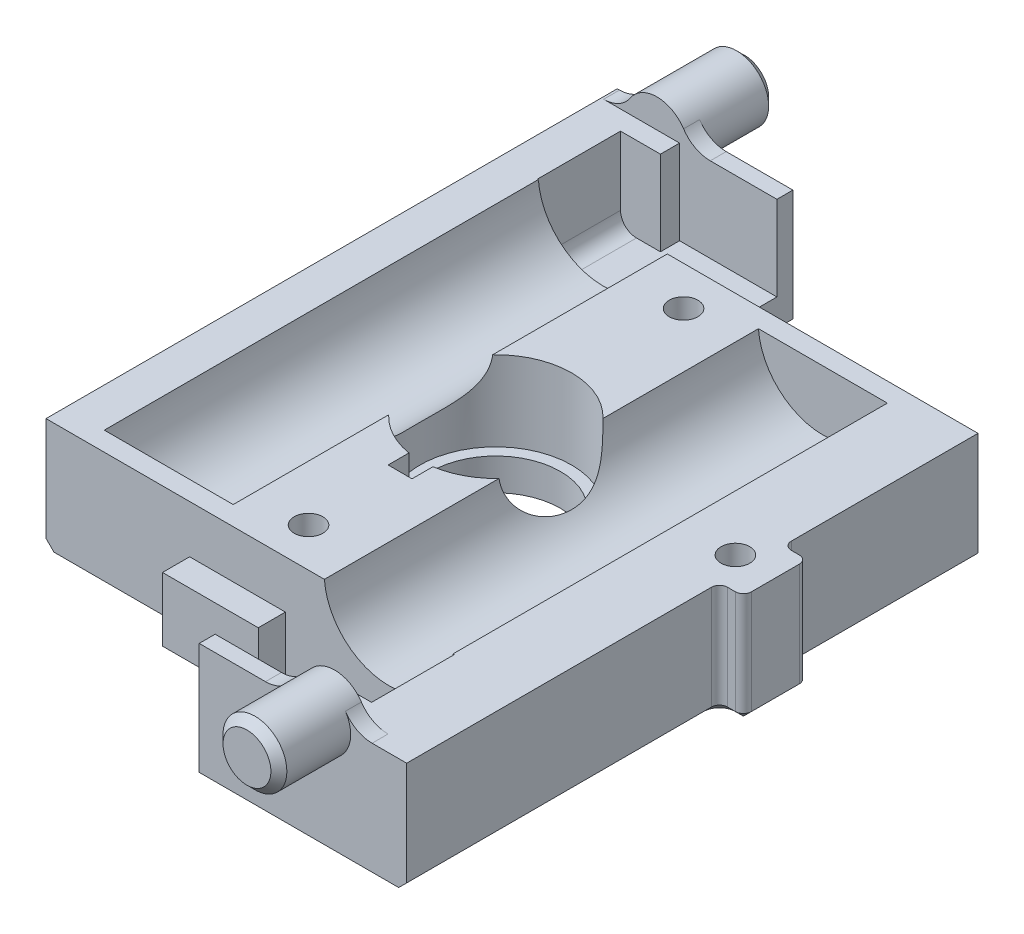
from build123d import *

# Parameters (mm, degrees)
SKETCH1_W            = 30
SKETCH1_H            = 30.8
BOSS_EXTRUDE1_DEPTH  = 7
SKETCH2_R            = 4.05
CUT_EXTRUDE1_DEPTH   = 6.5
SKETCH3_W            = 15
SKETCH3_H            = 1.2
SKETCH3_W_2          = 9
SKETCH3_W_3          = 11
SKETCH3_W_4          = 13
CUT_EXTRUDE2_DEPTH   = 4
SKETCH4_W            = 30
SKETCH4_H            = 3
CUT_EXTRUDE3_DEPTH   = 1.2
SKETCH5_W            = 30
SKETCH5_H            = 3
CUT_EXTRUDE4_DEPTH   = 1.2
SKETCH6_R            = 4.05
CUT_EXTRUDE5_DEPTH   = 27.2
SKETCH7_R            = 4.05
CUT_EXTRUDE6_DEPTH   = 27.2
SKETCH8_R            = 4.75
CUT_EXTRUDE7_DEPTH   = 5
BOSS_EXTRUDE2_DEPTH  = 6.4
FILLET1_R            = 1
BOSS_EXTRUDE3_DEPTH  = 6.4
FILLET2_R            = 1
SKETCH12_W           = 1.5
SKETCH12_H           = 1.344099237
CUT_EXTRUDE8_DEPTH   = 5
SKETCH13_W           = 13
SKETCH13_H           = 7
BOSS_EXTRUDE4_DEPTH  = 1
SKETCH14_W           = 11
SKETCH14_H           = 7
BOSS_EXTRUDE5_DEPTH  = 1
SKETCH15_R           = 2
BOSS_EXTRUDE8_DEPTH  = 5.5
SKETCH16_R           = 2
BOSS_EXTRUDE9_DEPTH  = 5.5
FILLET3_R            = 2
FILLET4_R            = 2
FILLET5_R            = 2
CHAMFER2_SIZE        = 0.5
CHAMFER3_SIZE        = 0.5
SKETCH17_W           = 4
SKETCH17_H           = 7
BOSS_EXTRUDE10_DEPTH = 1.5
FILLET7_R            = 0.5
SKETCH18_R           = 0.9
CUT_EXTRUDE9_DEPTH   = 99.965895754
SKETCH19_R           = 1.6
CUT_EXTRUDE10_DEPTH  = 2
SKETCH20_R           = 0.9
CUT_EXTRUDE11_DEPTH  = 99.965895754
SKETCH21_R           = 1.6
CUT_EXTRUDE12_DEPTH  = 2
CHAMFER6_SIZE        = 0.5
SKETCH22_W           = 6
SKETCH22_H           = 4
BOSS_EXTRUDE11_DEPTH = 0.5
SKETCH23_W           = 6
SKETCH23_H           = 4
BOSS_EXTRUDE12_DEPTH = 0.5
BOSS_EXTRUDE13_REACH = 100.822
SKETCH24_W           = 4.732966807
SKETCH24_H           = 1.2
SKETCH24_W_2         = 4.75835454


# Some blends are built 0.0001 mm under size
with BuildPart() as part:
    # Sketch1 → Boss-Extrude1 (new body)
    with BuildSketch(Plane(origin=(0, 0, 0), x_dir=(1, 0, 0), z_dir=(0, 1, 0))):
        with Locations((-46.45686042, -50.970505576)):
            Rectangle(SKETCH1_W, SKETCH1_H)
    extrude(amount=BOSS_EXTRUDE1_DEPTH)

    # Sketch2 → Cut-Extrude1 (cut)
    with BuildSketch(Plane.XZ):
        with Locations(Location((-47.47186042, 50.970505576, 0), (0, 0, 270))):
            Circle(SKETCH2_R)
    extrude(amount=-CUT_EXTRUDE1_DEPTH, mode=Mode.SUBTRACT)

    # Sketch3 → Cut-Extrude2 (cut)
    with BuildSketch(Plane.XZ):
        with Locations((-38.95686042, 65.770505576)):
            Rectangle(SKETCH3_W, SKETCH3_H)
        with Locations((-56.95686042, 65.770505576)):
            Rectangle(SKETCH3_W_2, SKETCH3_H)
        with Locations((-36.95686042, 36.170505576)):
            Rectangle(SKETCH3_W_3, SKETCH3_H)
        with Locations((-54.95686042, 36.170505576)):
            Rectangle(SKETCH3_W_4, SKETCH3_H)
    extrude(amount=-CUT_EXTRUDE2_DEPTH, mode=Mode.SUBTRACT)

    # Sketch4 → Cut-Extrude3 (cut)
    with BuildSketch(Plane.XY.offset(66.370505576)):
        with Locations((-46.45686042, 5.5)):
            Rectangle(SKETCH4_W, SKETCH4_H)
    extrude(amount=-CUT_EXTRUDE3_DEPTH, mode=Mode.SUBTRACT)

    # Sketch5 → Cut-Extrude4 (cut)
    with BuildSketch(Plane(origin=(0, 0, 35.570505576), x_dir=(-1, 0, 0), z_dir=(0, 0, -1))):
        with Locations((46.45686042, 5.5)):
            Rectangle(SKETCH5_W, SKETCH5_H)
    extrude(amount=-CUT_EXTRUDE4_DEPTH, mode=Mode.SUBTRACT)

    # Sketch6 → Cut-Extrude5 (cut)
    with BuildSketch(Plane.XY.offset(65.170505576)):
        with Locations((-39.974556342, 7.3)):
            Circle(SKETCH6_R)
    extrude(amount=-CUT_EXTRUDE5_DEPTH, mode=Mode.SUBTRACT)

    # Sketch7 → Cut-Extrude6 (cut)
    with BuildSketch(Plane(origin=(0, 0, 36.770505576), x_dir=(-1, 0, 0), z_dir=(0, 0, -1))):
        with Locations((54.96455223, 7.3)):
            Circle(SKETCH7_R)
    extrude(amount=-CUT_EXTRUDE6_DEPTH, mode=Mode.SUBTRACT)

    # Sketch8 → Cut-Extrude7 (cut)
    with BuildSketch(Plane(origin=(0, 7, 0), x_dir=(1, 0, 0), z_dir=(0, 1, 0))):
        with Locations(Location((-47.47186042, -50.970505576, 0), (0, 0, 270))):
            Circle(SKETCH8_R)
    extrude(amount=-CUT_EXTRUDE7_DEPTH, mode=Mode.SUBTRACT)

    # Sketch10 → Boss-Extrude2 (add)
    with BuildSketch(Plane.XY.offset(65.170505576)):
        Polygon((-31.45686042, 0), (-31.45686042, 7), (-35.85686042, 7), (-35.85686042, 1.7), (-44.45686042, 1.7), (-44.45686042, 0), align=None)
    extrude(amount=BOSS_EXTRUDE2_DEPTH)

    # Fillet1
    fillet1_edges = [part.edges().sort_by_distance(p)[0] for p in [
        (-35.85686042, 1.7, 68.370505576),
    ]]
    fillet(fillet1_edges, radius=FILLET1_R)

    # Sketch11 → Boss-Extrude3 (add)
    with BuildSketch(Plane(origin=(0, 0, 36.770505576), x_dir=(-1, 0, 0), z_dir=(0, 0, -1))):
        Polygon((61.45686042, 7), (61.45686042, 0), (50.45686042, 0), (50.45686042, 1.7), (59.05686042, 1.7), (59.05686042, 7), align=None)
    extrude(amount=BOSS_EXTRUDE3_DEPTH)

    # Fillet2
    fillet2_edges = [part.edges().sort_by_distance(p)[0] for p in [
        (-59.05686042, 1.7, 33.570505576),
    ]]
    fillet(fillet2_edges, radius=FILLET2_R)

    # Sketch12 → Cut-Extrude8 (cut)
    with BuildSketch(Plane(origin=(0, 7, 0), x_dir=(1, 0, 0), z_dir=(0, 1, 0))):
        with Locations((-47.47186042, -56.298455958)):
            Rectangle(SKETCH12_W, SKETCH12_H)
    extrude(amount=-CUT_EXTRUDE8_DEPTH, mode=Mode.SUBTRACT)

    # Sketch13 → Boss-Extrude4 (add)
    with BuildSketch(Plane.XY.offset(71.570505576)):
        with Locations((-37.95686042, 3.5)):
            Rectangle(SKETCH13_W, SKETCH13_H)
    extrude(amount=BOSS_EXTRUDE4_DEPTH)

    # Sketch14 → Boss-Extrude5 (add)
    with BuildSketch(Plane(origin=(0, 0, 30.370505576), x_dir=(-1, 0, 0), z_dir=(0, 0, -1))):
        with Locations((55.95686042, 3.5)):
            Rectangle(SKETCH14_W, SKETCH14_H)
    extrude(amount=BOSS_EXTRUDE5_DEPTH)

    # Sketch15 → Boss-Extrude8 (add)
    with BuildSketch(Plane.XY.offset(71.570505576)):
        with Locations(Location((-36.96455223, 6.8, 0), (0, 0, 174.260829523))):
            Circle(SKETCH15_R)
    extrude(amount=BOSS_EXTRUDE8_DEPTH)

    # Sketch16 → Boss-Extrude9 (add)
    with BuildSketch(Plane(origin=(0, 0, 30.370505576), x_dir=(-1, 0, 0), z_dir=(0, 0, -1))):
        with Locations(Location((57.974556342, 6.8, 0), (0, 0, 174.260829523))):
            Circle(SKETCH16_R)
    extrude(amount=BOSS_EXTRUDE9_DEPTH)

    # Fillet3
    fillet3_edges = [part.edges().sort_by_distance(p)[0] for p in [
        (-59.964531217, 7, 29.870505576),
    ]]
    fillet(fillet3_edges, radius=FILLET3_R)

    # Fillet4
    # the kernel refuses this fillet: 2 mm, written as the material it adds along each edge
    with BuildSketch(Plane(origin=(-55.984581468, 7, 30.370505576), x_dir=(1.0, 7.52728269616064e-12, 0), z_dir=(0, 0, -1))) as fillet4_piece_1:
        with BuildLine():
            CenterArc((1.350683743, -2), FILLET4_R, 90, 56.632987031)
            ThreePointArc((-0.319645565, -0.9), (-0.105311329, -0.469360383), (0, 0))
            Line((0, 0), (1.350683743, 0))
        make_face()
    extrude(amount=1)

    # Fillet5
    # the kernel refuses this fillet: 2 mm, written as the material it adds along each edge
    with BuildSketch(Plane(origin=(-38.954527104, 7, 71.570505576), x_dir=(-1.0, 7.116297137925098e-12, 0), z_dir=(0, 0, 1)), Plane(origin=(-34.974577356, 7, 72.570505576), x_dir=(1, 0, 0), z_dir=(0, 0, -1))) as fillet5_piece_1:
        with BuildLine():
            CenterArc((1.350683743, -2), FILLET5_R, 90, 56.632987031)
            ThreePointArc((-0.319645565, -0.9), (-0.105311329, -0.469360383), (0, 0))
            Line((0, 0), (1.350683743, 0))
        make_face()
    extrude(amount=1)

    # Chamfer2
    chamfer2_edges = [part.edges().sort_by_distance(p)[0] for p in [
        (-34.974577356, 6.6, 77.070505576),
    ]]
    chamfer(chamfer2_edges, length=CHAMFER2_SIZE)

    # Chamfer3
    chamfer3_edges = [part.edges().sort_by_distance(p)[0] for p in [
        (-59.964531217, 6.6, 24.870505576),
    ]]
    chamfer(chamfer3_edges, length=CHAMFER3_SIZE)

    # Sketch17 → Boss-Extrude10 (add)
    with BuildSketch(Plane(origin=(-31.45686042, 0, 0), x_dir=(0, 0, -1), z_dir=(1, 0, 0))):
        with Locations((-50.970505576, 3.5)):
            Rectangle(SKETCH17_W, SKETCH17_H)
    extrude(amount=BOSS_EXTRUDE10_DEPTH)

    # Fillet7
    fillet7_edges = [part.edges().sort_by_distance(p)[0] for p in [
        (-31.45686042, 3.5, 52.970505576),
        (-31.45686042, 3.5, 48.970505576),
        (-29.95686042, 3.5, 52.970505576),
        (-29.95686042, 3.5, 48.970505576),
    ]]
    fillet(fillet7_edges, radius=FILLET7_R)

    # Sketch18 → Cut-Extrude9 (cut, through all)
    with BuildSketch(Plane.XZ):
        with Locations(Location((-32.45686042, 50.970505576, 0), (0, 0, 270))):
            Circle(SKETCH18_R)
    extrude(amount=-CUT_EXTRUDE9_DEPTH, mode=Mode.SUBTRACT)

    # Sketch19 → Cut-Extrude10 (cut)
    with BuildSketch(Plane.XZ):
        with Locations(Location((-32.45686042, 50.970505576, 0), (0, 0, 270))):
            Circle(SKETCH19_R)
    extrude(amount=-CUT_EXTRUDE10_DEPTH, mode=Mode.SUBTRACT)

    # Sketch20 → Cut-Extrude11 (cut, through all)
    with BuildSketch(Plane.XZ):
        with Locations(Location((-47.45686042, 62.720505576, 0), (0, 0, 270))):
            Circle(SKETCH20_R)
        with Locations(Location((-47.45686042, 39.220505576, 0), (0, 0, 270))):
            Circle(SKETCH20_R)
    extrude(amount=-CUT_EXTRUDE11_DEPTH, mode=Mode.SUBTRACT)

    # Sketch21 → Cut-Extrude12 (cut)
    with BuildSketch(Plane.XZ):
        with Locations(Location((-47.45686042, 62.720505576, 0), (0, 0, 270))):
            Circle(SKETCH21_R)
        with Locations(Location((-47.45686042, 39.220505576, 0), (0, 0, 270))):
            Circle(SKETCH21_R)
    extrude(amount=-CUT_EXTRUDE12_DEPTH, mode=Mode.SUBTRACT)

    # Chamfer6
    chamfer6_edges = [part.edges().sort_by_distance(p)[0] for p in [
        (-61.45686042, 0, 47.270505576),
        (-31.45686042, 0, 63.020505576),
        (-30.70686042, 0, 52.970505576),
        (-29.95686042, 0, 50.970505576),
        (-31.45686042, 0, 42.620505576),
        (-30.70686042, 0, 48.970505576),
        (-30.103307029, 0, 49.116952185),
        (-30.103307029, 0, 52.824058967),
        (-31.310413811, 0, 53.116952185),
        (-31.310413811, 0, 48.824058967),
    ]]
    chamfer(chamfer6_edges, length=CHAMFER6_SIZE - 0.0001)  # a hair under: the kernel refuses the full size

    # Sketch22 → Boss-Extrude11 (add)
    with BuildSketch(Plane(origin=(0, 0, 35.570505576), x_dir=(-1, 0, 0), z_dir=(0, 0, -1))):
        with Locations((45.45686042, 2)):
            Rectangle(SKETCH22_W, SKETCH22_H)
    extrude(amount=BOSS_EXTRUDE11_DEPTH)

    # Sketch23 → Boss-Extrude12 (add)
    with BuildSketch(Plane.XY.offset(66.370505576)):
        with Locations((-49.45686042, 2)):
            Rectangle(SKETCH23_W, SKETCH23_H)
    extrude(amount=BOSS_EXTRUDE12_DEPTH)

    # Boss-Extrude13: up to this face of the body (flat: up to its plane)
    boss_extrude13_end = Plane(part.part.faces().sort_by_distance((-54.25686042, 1.7, 33.570505576))[0])
    # Sketch24 → Boss-Extrude13 (add, up to the picked face)
    with BuildSketch(Plane(origin=(0, 7, 0), x_dir=(1, 0, 0), z_dir=(0, 1, 0)), mode=Mode.PRIVATE) as boss_extrude13_sk1:
        with Locations((-35.990377017, -70.970505576)):
            Rectangle(SKETCH24_W, SKETCH24_H)
    boss_extrude13_tool1 = split(extrude(boss_extrude13_sk1.sketch, amount=-BOSS_EXTRUDE13_REACH, mode=Mode.PRIVATE), bisect_by=boss_extrude13_end, keep=Keep.BOTH, mode=Mode.PRIVATE)
    # Sketch24 → Boss-Extrude13 (add, up to the picked face)
    with BuildSketch(Plane(origin=(0, 7, 0), x_dir=(1, 0, 0), z_dir=(0, 1, 0)), mode=Mode.PRIVATE) as boss_extrude13_sk2:
        with Locations((-58.93603769, -30.970505576)):
            Rectangle(SKETCH24_W_2, SKETCH24_H)
    boss_extrude13_tool2 = split(extrude(boss_extrude13_sk2.sketch, amount=-BOSS_EXTRUDE13_REACH, mode=Mode.PRIVATE), bisect_by=boss_extrude13_end, keep=Keep.BOTH, mode=Mode.PRIVATE)
    add(boss_extrude13_tool1.solids().sort_by(Axis((-35.990377, 7, 70.970506), (0, -1, 0)))[0])
    add(boss_extrude13_tool2.solids().sort_by(Axis((-58.936038, 7, 30.970506), (0, -1, 0)))[0])


solid = part.part
